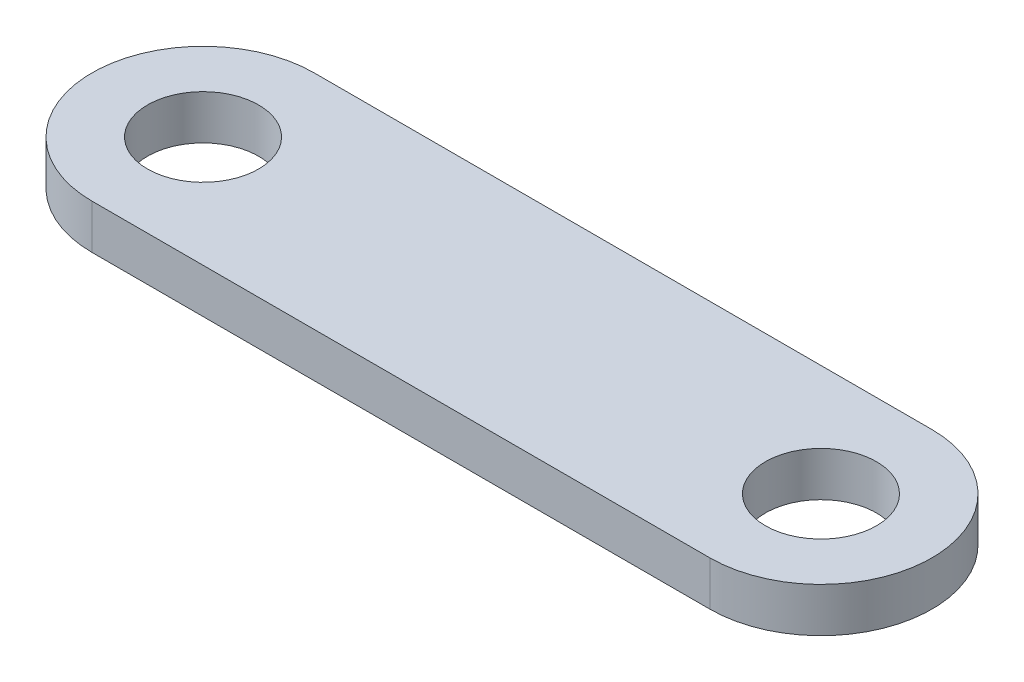
from build123d import *

# Parameters (mm, degrees)
SKETCH1_R           = 3.175
BOSS_EXTRUDE1_DEPTH = 2.54


with BuildPart() as part:
    # Sketch1 → Boss-Extrude1 (new body)
    with BuildSketch(Plane(origin=(0, 0, 0), x_dir=(1, 0, 0), z_dir=(0, 1, 0))):
        with BuildLine():
            Line((-17.660366, 6.35), (17.660366, 6.35))
            ThreePointArc((17.660366, 6.35), (24.010366, 0), (17.660366, -6.35))
            Line((17.660366, -6.35), (-17.660366, -6.35))
            ThreePointArc((-17.660366, -6.35), (-24.010366, 0), (-17.660366, 6.35))
        make_face()
        with Locations((-17.660366, 0)):
            Circle(SKETCH1_R, mode=Mode.SUBTRACT)
        with Locations((17.660366, 0)):
            Circle(SKETCH1_R, mode=Mode.SUBTRACT)
    extrude(amount=BOSS_EXTRUDE1_DEPTH)


solid = part.part
